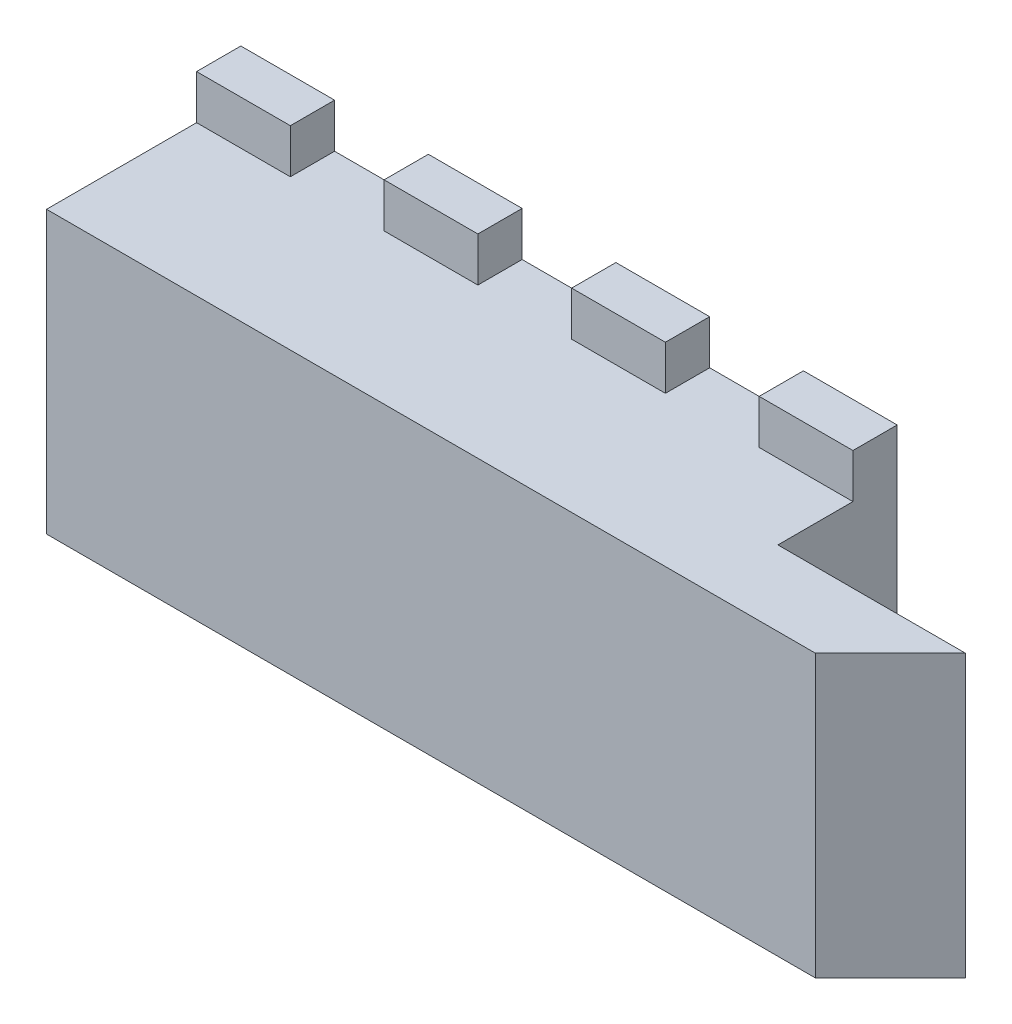
from build123d import *

# Parameters (mm, degrees)
SKETCH1_W               = 44.45
SKETCH1_H               = 19.05
BODY_DEPTH              = 2.9972
SKETCH2_W               = 6.35
SKETCH2_H               = 2.9972
TAB_DEPTH               = 2.9972
LPATTERN1_COUNT         = 4
LPATTERN1_PITCH         = 12.7
MIRROR1_COPY_1_SKETCH_W = 6.35
MIRROR1_COPY_1_SKETCH_H = 2.9972
MIRROR1_COPY_1_DEPTH    = 2.9972
MIRROR1_COPY_2_SKETCH_W = 6.35
MIRROR1_COPY_2_SKETCH_H = 2.9972
MIRROR1_COPY_2_DEPTH    = 2.9972
MIRROR1_COPY_3_SKETCH_W = 6.35
MIRROR1_COPY_3_SKETCH_H = 2.9972
MIRROR1_COPY_3_DEPTH    = 2.9972
SKETCH3_W               = 44.45
SKETCH3_H               = 19.05
BOSS_EXTRUDE1_DEPTH     = 10.16
SKETCH4_W               = 5.08
SKETCH4_H               = 19.05
BOSS_EXTRUDE2_DEPTH     = 12.7
CHAMFER1_SIZE           = 5.08


with BuildPart() as part:
    # Sketch1 → Body (new body)
    with BuildSketch(Plane.XY):
        Rectangle(SKETCH1_W, SKETCH1_H)
    extrude(amount=BODY_DEPTH)

    # Sketch2 → Tab (add)
    with BuildSketch(Plane(origin=(0, 9.525, 0), x_dir=(1, 0, 0), z_dir=(0, 1, 0))):
        with Locations((-19.05, -1.4986)):
            Rectangle(SKETCH2_W, SKETCH2_H)
    tab = extrude(amount=TAB_DEPTH)

    # LPattern1: Tab ×4
    with Locations(*[(i * LPATTERN1_PITCH, 0, 0) for i in range(1, LPATTERN1_COUNT)]):
        add(tab)

    # Mirror1: Tab across plane
    add(tab.mirror(Plane.ZX))

    # Mirror1 copy 1 sketch → Mirror1 copy 1 (add)
    with BuildSketch(Plane(origin=(12.7, -9.525, 0), x_dir=(1, 0, 0), z_dir=(0, -1, 0))):
        with Locations((-19.05, 1.4986)):
            Rectangle(MIRROR1_COPY_1_SKETCH_W, MIRROR1_COPY_1_SKETCH_H)
    extrude(amount=MIRROR1_COPY_1_DEPTH)

    # Mirror1 copy 2 sketch → Mirror1 copy 2 (add)
    with BuildSketch(Plane(origin=(25.4, -9.525, 0), x_dir=(1, 0, 0), z_dir=(0, -1, 0))):
        with Locations((-19.05, 1.4986)):
            Rectangle(MIRROR1_COPY_2_SKETCH_W, MIRROR1_COPY_2_SKETCH_H)
    extrude(amount=MIRROR1_COPY_2_DEPTH)

    # Mirror1 copy 3 sketch → Mirror1 copy 3 (add)
    with BuildSketch(Plane(origin=(38.1, -9.525, 0), x_dir=(1, 0, 0), z_dir=(0, -1, 0))):
        with Locations((-19.05, 1.4986)):
            Rectangle(MIRROR1_COPY_3_SKETCH_W, MIRROR1_COPY_3_SKETCH_H)
    extrude(amount=MIRROR1_COPY_3_DEPTH)

    # Sketch3 → Boss-Extrude1 (add)
    with BuildSketch(Plane.XY.offset(2.9972)):
        Rectangle(SKETCH3_W, SKETCH3_H)
    extrude(amount=BOSS_EXTRUDE1_DEPTH)

    # Sketch4 → Boss-Extrude2 (add)
    with BuildSketch(Plane(origin=(22.225, 0, 0), x_dir=(0, 0, -1), z_dir=(1, 0, 0))):
        with Locations((-10.6172, 0)):
            Rectangle(SKETCH4_W, SKETCH4_H)
    extrude(amount=BOSS_EXTRUDE2_DEPTH)

    # Chamfer1
    chamfer1_edges = [part.edges().sort_by_distance(p)[0] for p in [
        (34.925, 0, 13.1572),
    ]]
    chamfer(chamfer1_edges, length=CHAMFER1_SIZE - 0.0001)  # a hair under: the kernel refuses the full size


solid = part.part
